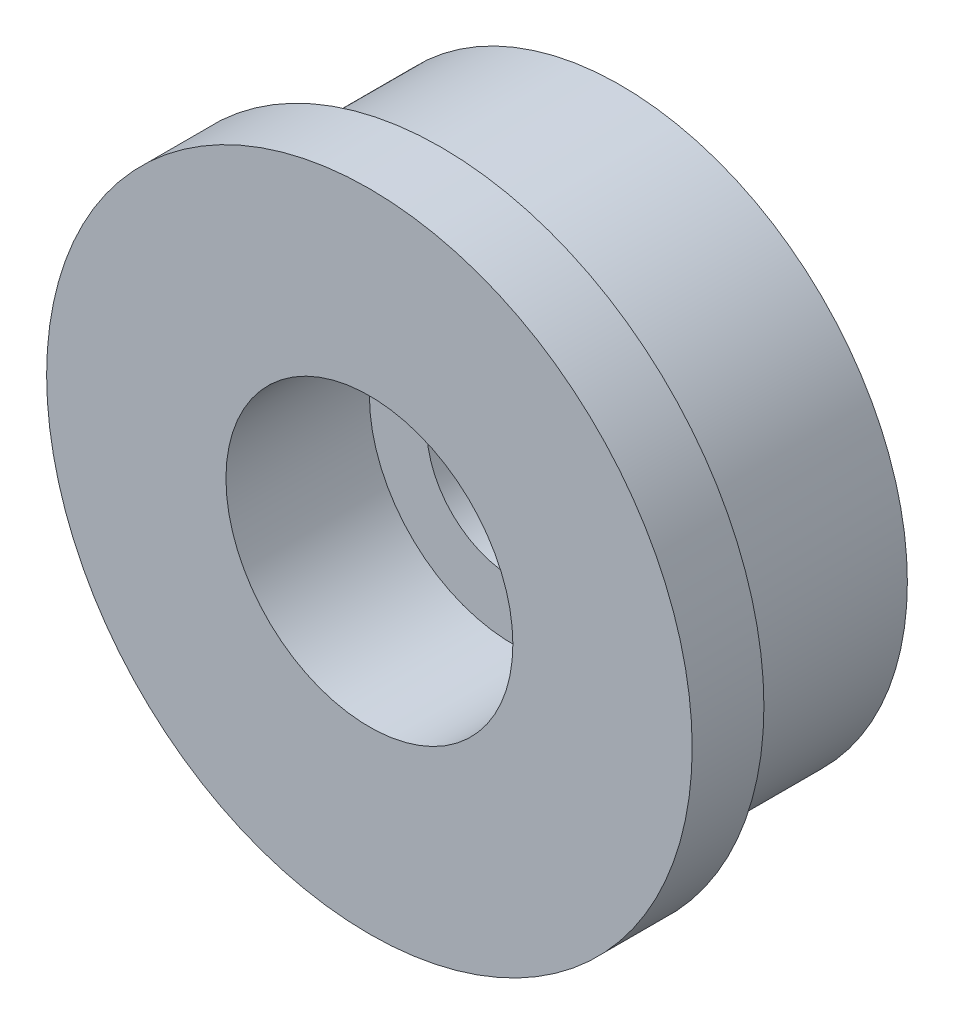
from build123d import *

# Parameters (mm, degrees)
SKETCH_1_R                   = 9
EXTRUDE_1_DEPTH              = 2
SKETCH_2_R                   = 8
EXTRUDE_2_DEPTH              = 5
HOLE_WIZARD_M4_2_D           = 4.8
HOLE_WIZARD_M4_2_CBORE_D     = 8
HOLE_WIZARD_M4_2_CBORE_DEPTH = 4
CUT_EXTRUDE_START            = -2
SKETCH_5_R                   = 4
CUT_EXTRUDE_3_DEPTH          = 2


with BuildPart() as part:
    # 草图1 → 凸台-拉伸1 (new body)
    with BuildSketch(Plane.XY):
        Circle(SKETCH_1_R)
    extrude(amount=EXTRUDE_1_DEPTH)

    # 草图2 → 凸台-拉伸2 (add)
    with BuildSketch(Plane.XY):
        Circle(SKETCH_2_R)
    extrude(amount=-EXTRUDE_2_DEPTH)

    # M4 六角凹头盖的柱孔2 (through all)
    with Locations(Plane.XY.offset(2)):
        with Locations((0, 0)):
            CounterBoreHole(HOLE_WIZARD_M4_2_D / 2, HOLE_WIZARD_M4_2_CBORE_D / 2, HOLE_WIZARD_M4_2_CBORE_DEPTH)

    # 草图5 → 切除-拉伸3 (cut)
    with BuildSketch(Plane(origin=(0, 0, -5), x_dir=(-1, 0, 0), z_dir=(0, 0, -1)).offset(CUT_EXTRUDE_START)):
        Circle(SKETCH_5_R)
    extrude(amount=CUT_EXTRUDE_3_DEPTH, mode=Mode.SUBTRACT)


solid = part.part
